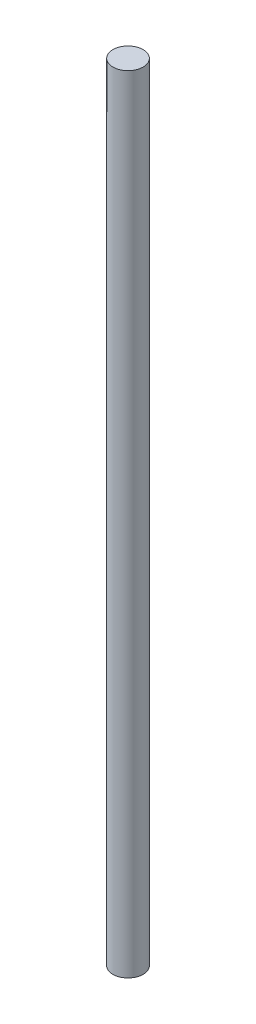
from build123d import *

# Parameters (mm, degrees)
SKETCH1_W = 6.35
SKETCH1_H = 330.2


with BuildPart() as part:
    # Sketch1 → Revolve1 (revolve)
    with BuildSketch(Plane.XY):
        with Locations((3.175, 165.1)):
            Rectangle(SKETCH1_W, SKETCH1_H)
    revolve(axis=Axis((0, 0, 0), (0, 1, 0)))


solid = part.part
